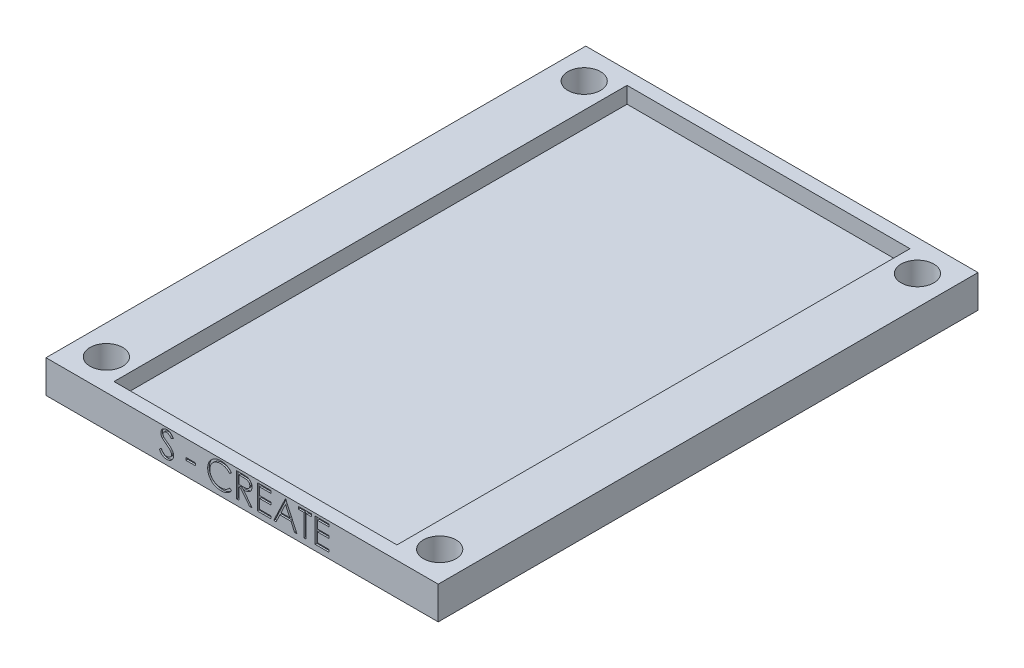
from build123d import *

# Parameters (mm, degrees)
SKETCH1_W           = 304.546
SKETCH1_H           = 419.1
BOSS_EXTRUDE1_DEPTH = 25.4
CUT_EXTRUDE1_REACH  = 262.276
SKETCH2_R           = 12.7
SKETCH3_W           = 219.698600032
SKETCH3_H           = 398.34825111
CUT_EXTRUDE2_DEPTH  = 12.7
WRAP1_START         = -1.27
WRAP1_OUTLINE_W     = 7.326923077
WRAP1_OUTLINE_H     = 1.953846154
WRAP1_DEPTH         = 1.27


# Read off the part's stored shape, not the designer's step: Wrap1
with BuildPart() as part:
    # Sketch1 → Boss-Extrude1 (new body)
    with BuildSketch(Plane(origin=(0, 0, 0), x_dir=(1, 0, 0), z_dir=(0, 1, 0))):
        Rectangle(SKETCH1_W, SKETCH1_H)
    extrude(amount=BOSS_EXTRUDE1_DEPTH)

    # Sketch2 → Cut-Extrude1 (cut, up to next)
    with BuildSketch(Plane(origin=(0, 25.4, 0), x_dir=(1, 0, 0), z_dir=(0, 1, 0)), mode=Mode.PRIVATE) as cut_extrude1_sk1:
        with Locations(Location((-129.389965873, 185.42, 0), (0, 0, 270))):
            Circle(SKETCH2_R)
    cut_extrude1_tool1 = extrude(cut_extrude1_sk1.sketch, amount=-CUT_EXTRUDE1_REACH, mode=Mode.PRIVATE) & part.part
    # Sketch2 → Cut-Extrude1 (cut, up to next)
    with BuildSketch(Plane(origin=(0, 25.4, 0), x_dir=(1, 0, 0), z_dir=(0, 1, 0)), mode=Mode.PRIVATE) as cut_extrude1_sk2:
        with Locations(Location((-129.389965873, -185.53228954, 0), (0, 0, 270))):
            Circle(SKETCH2_R)
    cut_extrude1_tool2 = extrude(cut_extrude1_sk2.sketch, amount=-CUT_EXTRUDE1_REACH, mode=Mode.PRIVATE) & part.part
    cut_extrude1_1 = cut_extrude1_tool1.solids().sort_by_distance((-129.389966, 25.4, -185.42))[0]
    add(cut_extrude1_1, mode=Mode.SUBTRACT)
    cut_extrude1_2 = cut_extrude1_tool2.solids().sort_by_distance((-129.389966, 25.4, 185.53229))[0]
    add(cut_extrude1_2, mode=Mode.SUBTRACT)
    cut_extrude1 = cut_extrude1_1 + cut_extrude1_2  # Cut-Extrude1 as one shape, for the pattern or mirror that repeats it

    # Mirror1: Cut-Extrude1 across plane
    add(cut_extrude1.mirror(Plane(origin=(0, 0, 0), x_dir=(0, 0, 1), z_dir=(1, 0, 0))), mode=Mode.SUBTRACT)

    # Sketch3 → Cut-Extrude2 (cut)
    with BuildSketch(Plane(origin=(0, 25.4, 0), x_dir=(1, 0, 0), z_dir=(0, 1, 0))):
        Rectangle(SKETCH3_W, SKETCH3_H)
    extrude(amount=-CUT_EXTRUDE2_DEPTH, mode=Mode.SUBTRACT)

    # Wrap1 outline → Wrap1 (cut)
    # profile 1 of 8: a face of its own
    with BuildSketch(Plane.XY.offset(209.55).offset(WRAP1_START)):
        with BuildLine():
            add(Edge.make_bspline(
                [(-62.746564703, 9.040953764), (-62.596786869, 8.790231897), (-62.309818318, 8.309858476), (-61.831111635, 7.660753999), (-61.335088218, 7.10905426), (-60.818074846, 6.657968725), (-60.283227328, 6.302828355), (-59.727054121, 6.051356209), (-59.151429466, 5.894514971), (-58.759686238, 5.8754645), (-58.56411278, 5.865953764)],
                knots=[0, 0, 0, 0, 0.159004299, 0.3046461, 0.438546905, 0.562322299, 0.677432543, 0.786897393, 0.893610889, 1, 1, 1, 1], degree=3))
            Line((-62.746564703, 9.040953764), (-64.356961337, 8.075479004))
            add(Edge.make_bspline(
                [(-58.56411278, 3.91210761), (-58.707996575, 3.914889898), (-58.993952098, 3.920419435), (-59.416913706, 3.969303261), (-59.831330613, 4.038466211), (-60.232002634, 4.148270792), (-60.624091974, 4.281495481), (-61.005893351, 4.44553412), (-61.377591801, 4.642114888), (-61.741270359, 4.866877808), (-62.096004081, 5.128449246), (-62.438465756, 5.433104991), (-62.779891752, 5.772442668), (-63.11020458, 6.155677306), (-63.436085551, 6.576617442), (-63.751109466, 7.039201426), (-64.061797101, 7.540909595), (-64.256735576, 7.89396099), (-64.356961337, 8.075479004)],
                knots=[0, 0, 0, 0, 0.057208269, 0.11369606, 0.169177916, 0.224159217, 0.278719878, 0.333794217, 0.389241459, 0.445822073, 0.503704281, 0.564293892, 0.627975416, 0.69503826, 0.765372726, 0.839611443, 0.91753775, 1, 1, 1, 1], degree=3))
            add(Edge.make_bspline(
                [(-53.122345953, 9.067666504), (-53.125922662, 8.896878546), (-53.133006622, 8.558619215), (-53.214436739, 8.061930868), (-53.333742345, 7.579525706), (-53.51355929, 7.117366651), (-53.733032479, 6.666998729), (-54.011523057, 6.240235728), (-54.334326313, 5.82763233), (-54.704624376, 5.440190755), (-55.109822787, 5.084520746), (-55.538086897, 4.768132568), (-55.990117668, 4.504326408), (-56.463462906, 4.289056825), (-56.958231338, 4.120690108), (-57.474256562, 3.998700063), (-58.012389187, 3.923829694), (-58.378151808, 3.916058592), (-58.56411278, 3.91210761)],
                knots=[0, 0, 0, 0, 0.061484255, 0.121774528, 0.18091956, 0.240256115, 0.300114444, 0.361145948, 0.423500582, 0.488669361, 0.553954105, 0.617581261, 0.680238427, 0.742187389, 0.804663212, 0.868258989, 0.933020257, 1, 1, 1, 1], degree=3))
            add(Edge.make_bspline(
                [(-57.610086337, 15.215412898), (-57.403334438, 15.064964927), (-57.002988039, 14.773643283), (-56.433351783, 14.335952224), (-55.916858342, 13.907883655), (-55.451694334, 13.492171251), (-55.033264304, 13.091968345), (-54.666210424, 12.702460177), (-54.34679265, 12.326437275), (-54.002917189, 11.844349398), (-53.6515382, 11.252269497), (-53.349777995, 10.526855084), (-53.159504704, 9.798620825), (-53.134622599, 9.309161901), (-53.122345953, 9.067666504)],
                knots=[0, 0, 0, 0, 0.09697231, 0.187773439, 0.272396139, 0.351320997, 0.424334774, 0.491908784, 0.55423322, 0.611267658, 0.716347845, 0.814540086, 0.908495456, 1, 1, 1, 1], degree=3))
            add(Edge.make_bspline(
                [(-60.170693308, 17.112017466), (-60.128993553, 17.074804511), (-60.029924479, 16.986395049), (-59.848808369, 16.841657064), (-59.609633996, 16.66311626), (-59.318646872, 16.442205295), (-58.97048166, 16.185947623), (-58.565100076, 15.897619819), (-58.107020876, 15.567861821), (-57.78196302, 15.337315778), (-57.610086337, 15.215412898)],
                knots=[0, 0, 0, 0, 0.052594282, 0.124951974, 0.218093899, 0.333502411, 0.468789179, 0.624937586, 0.801683048, 1, 1, 1, 1], degree=3))
            add(Edge.make_bspline(
                [(-61.426192107, 19.573405687), (-61.424052374, 19.471344068), (-61.419769411, 19.267053939), (-61.360035155, 18.965239771), (-61.283294522, 18.664188052), (-61.161686769, 18.36525228), (-60.993800188, 18.063204412), (-60.773336302, 17.75284324), (-60.495678132, 17.431433226), (-60.282987536, 17.222387377), (-60.170693308, 17.112017466)],
                knots=[0, 0, 0, 0, 0.107285214, 0.214745861, 0.32293856, 0.434116163, 0.553412311, 0.686072985, 0.834255992, 1, 1, 1, 1], degree=3))
            add(Edge.make_bspline(
                [(-58.632802683, 21.985184533), (-58.82959747, 21.978589423), (-59.209097676, 21.965871376), (-59.74788739, 21.826969741), (-60.232812896, 21.608265616), (-60.649477572, 21.301751235), (-60.996388833, 20.938598404), (-61.247334258, 20.520702064), (-61.39837444, 20.059243558), (-61.416805476, 19.737343972), (-61.426192107, 19.573405687)],
                knots=[0, 0, 0, 0, 0.143073084, 0.275902964, 0.402370856, 0.528413645, 0.650356379, 0.765895086, 0.880774131, 1, 1, 1, 1], degree=3))
            add(Edge.make_bspline(
                [(-54.912099558, 19.542876841), (-55.005422419, 19.663102427), (-55.18514043, 19.894628797), (-55.457988066, 20.218866958), (-55.715155707, 20.515048082), (-55.968522883, 20.772305422), (-56.20470822, 21.004727033), (-56.433945264, 21.203716567), (-56.65293509, 21.371223736), (-56.928979989, 21.549986541), (-57.275786427, 21.727186939), (-57.711130832, 21.877132635), (-58.166078986, 21.967239472), (-58.475938837, 21.979153275), (-58.632802683, 21.985184533)],
                knots=[0, 0, 0, 0, 0.098469431, 0.189629101, 0.274184089, 0.352183161, 0.423198873, 0.488550946, 0.548473346, 0.601440164, 0.701198082, 0.799591802, 0.898545098, 1, 1, 1, 1], degree=3))
            Line((-54.912099558, 19.542876841), (-53.366576722, 20.714421312))
            add(Edge.make_bspline(
                [(-58.441997395, 23.939030687), (-58.217511649, 23.931287942), (-57.771081149, 23.915890093), (-57.114404704, 23.782009244), (-56.482158519, 23.560481302), (-55.973560178, 23.309083035), (-55.575509005, 23.057996329), (-55.271945988, 22.829288429), (-54.964329577, 22.565989623), (-54.65017845, 22.267398584), (-54.334815718, 21.930775553), (-54.0135595, 21.558425946), (-53.685658551, 21.152625263), (-53.474715941, 20.862931909), (-53.366576722, 20.714421312)],
                knots=[0, 0, 0, 0, 0.107232799, 0.213251813, 0.318830447, 0.426793531, 0.483645951, 0.543603822, 0.60830765, 0.67712676, 0.750685636, 0.828713418, 0.912190348, 1, 1, 1, 1], degree=3))
            add(Edge.make_bspline(
                [(-63.135807491, 19.493267466), (-63.128703425, 19.694815239), (-63.114647137, 20.093602843), (-62.995772322, 20.676156363), (-62.808141286, 21.232342434), (-62.545279111, 21.756654679), (-62.206421233, 22.235440946), (-61.814285287, 22.674208639), (-61.347225626, 23.043063351), (-60.834766348, 23.365346126), (-60.273845237, 23.617600376), (-59.686066177, 23.807887997), (-59.070494971, 23.915706957), (-58.653555052, 23.93117972), (-58.441997395, 23.939030687)],
                knots=[0, 0, 0, 0, 0.083785371, 0.165779888, 0.246280008, 0.327460928, 0.408796954, 0.489715241, 0.571376032, 0.655523321, 0.741019483, 0.826546761, 0.911988852, 1, 1, 1, 1], degree=3))
            add(Edge.make_bspline(
                [(-62.071113982, 16.593027081), (-62.155328835, 16.705155582), (-62.320948646, 16.925671327), (-62.539566476, 17.270339481), (-62.725381062, 17.623163254), (-62.871044613, 17.985090746), (-62.993706032, 18.351040858), (-63.076208484, 18.725788353), (-63.127868801, 19.107651691), (-63.133159185, 19.36462803), (-63.135807491, 19.493267466)],
                knots=[0, 0, 0, 0, 0.133506769, 0.262558979, 0.388264447, 0.512667355, 0.63372227, 0.75539386, 0.877552945, 1, 1, 1, 1], degree=3))
            add(Edge.make_bspline(
                [(-58.949539462, 14.001891264), (-59.149967213, 14.144649719), (-59.53316981, 14.417593015), (-60.069065808, 14.822673761), (-60.548279242, 15.193026822), (-60.968680175, 15.53213866), (-61.330083695, 15.840055266), (-61.635337689, 16.113819763), (-61.876666122, 16.360836001), (-62.010862925, 16.521081019), (-62.071113982, 16.593027081)],
                knots=[0, 0, 0, 0, 0.181535301, 0.347081672, 0.495567816, 0.628357302, 0.74551967, 0.845830751, 0.930781807, 1, 1, 1, 1], degree=3))
            add(Edge.make_bspline(
                [(-55.51504427, 10.964271072), (-55.600337184, 11.073383069), (-55.779398989, 11.302450058), (-56.08723345, 11.643419125), (-56.44845473, 11.995127948), (-56.850701221, 12.37100653), (-57.308625605, 12.753572966), (-57.807885362, 13.161070307), (-58.361227223, 13.578001748), (-58.749300197, 13.857615284), (-58.949539462, 14.001891264)],
                knots=[0, 0, 0, 0, 0.090279215, 0.189529918, 0.299197872, 0.418925887, 0.548376285, 0.68813637, 0.839083502, 1, 1, 1, 1], degree=3))
            add(Edge.make_bspline(
                [(-54.831961337, 9.094379245), (-54.8399858, 9.252988727), (-54.85629836, 9.575418626), (-54.994173987, 10.051122451), (-55.211067745, 10.521889154), (-55.411161562, 10.8130889), (-55.51504427, 10.964271072)],
                knots=[0, 0, 0, 0, 0.234723374, 0.477158319, 0.728556284, 1, 1, 1, 1], degree=3))
            add(Edge.make_bspline(
                [(-58.56411278, 5.865953764), (-58.397088582, 5.870605624), (-58.065962717, 5.879827948), (-57.578488223, 5.968442028), (-57.105058699, 6.104579473), (-56.655431685, 6.299547686), (-56.235811269, 6.535432872), (-55.867837685, 6.820345638), (-55.54972384, 7.139330844), (-55.289505659, 7.495199293), (-55.089861467, 7.877925487), (-54.936416066, 8.270768879), (-54.851262165, 8.679900658), (-54.838434693, 8.955366177), (-54.831961337, 9.094379245)],
                knots=[0, 0, 0, 0, 0.091263605, 0.180930311, 0.27008822, 0.360156133, 0.448342532, 0.532665842, 0.613833704, 0.693981527, 0.772715977, 0.849335172, 0.923967327, 1, 1, 1, 1], degree=3))
        make_face()
    # profile 2 of 8: a face of its own
    with BuildSketch(Plane.XY.offset(209.55).offset(WRAP1_START)):
        with BuildLine():
            add(Edge.make_bspline(
                [(-0.463902443, 23.450569148), (-0.209497158, 23.449722316), (0.278989171, 23.448096304), (0.978795114, 23.439029795), (1.614668313, 23.413043659), (2.186276296, 23.390681226), (2.693608575, 23.349903659), (3.138220829, 23.31092928), (3.518065297, 23.259909784), (3.74800343, 23.21252741), (3.852113182, 23.191073956)],
                knots=[0, 0, 0, 0, 0.176257755, 0.338434414, 0.484822051, 0.617157578, 0.734698361, 0.837385184, 0.926372421, 1, 1, 1, 1], degree=3))
            Line((-0.463902443, 23.450569148), (-4.276192107, 23.450569148))
            Line((-4.276192107, 23.450569148), (-4.276192107, 4.400569148))
            Line((-4.276192107, 4.400569148), (-2.566576722, 4.400569148))
            Line((-2.566576722, 4.400569148), (-2.566576722, 13.192876841))
            Line((-2.566576722, 13.192876841), (-1.177514222, 13.192876841))
            Line((-1.177514222, 13.192876841), (5.821223759, 4.400569148))
            Line((5.821223759, 4.400569148), (7.935346355, 4.400569148))
            Line((7.935346355, 4.400569148), (0.936608374, 13.192876841))
            add(Edge.make_bspline(
                [(7.691115586, 18.356067947), (7.683120039, 18.102239734), (7.667518656, 17.606955149), (7.522057735, 16.888166637), (7.283788392, 16.217664796), (6.955457347, 15.596293867), (6.537339915, 15.036165926), (6.034829266, 14.544183591), (5.447645067, 14.132486352), (4.901022647, 13.846993229), (4.418163932, 13.664151827), (4.020654043, 13.535502502), (3.587038066, 13.436105234), (3.121470573, 13.347059374), (2.622014105, 13.279830866), (2.089865748, 13.230591544), (1.52464598, 13.199817365), (1.136357617, 13.195234453), (0.936608374, 13.192876841)],
                knots=[0, 0, 0, 0, 0.078780236, 0.153720644, 0.22671353, 0.299191166, 0.371189997, 0.443006414, 0.516689173, 0.593217217, 0.633872918, 0.676989142, 0.722899506, 0.771958611, 0.824211323, 0.879378651, 0.937948119, 1, 1, 1, 1], degree=3))
            add(Edge.make_bspline(
                [(3.852113182, 23.191073956), (3.991486379, 23.156638276), (4.267259565, 23.088501523), (4.664316353, 22.944485695), (5.042672887, 22.777827453), (5.400757502, 22.582082061), (5.736776595, 22.355796474), (6.054194829, 22.102877122), (6.354452565, 21.824707902), (6.625406867, 21.514275408), (6.88088942, 21.188593833), (7.096364658, 20.836420528), (7.282110212, 20.4681485), (7.429995455, 20.080032412), (7.549074139, 19.675836196), (7.633036956, 19.251898603), (7.683389849, 18.81015101), (7.688516234, 18.508845821), (7.691115586, 18.356067947)],
                knots=[0, 0, 0, 0, 0.064216843, 0.127063766, 0.188744538, 0.249132103, 0.309452533, 0.369826676, 0.430650142, 0.492351932, 0.554072106, 0.615689784, 0.676797703, 0.738439048, 0.80131691, 0.865184512, 0.931641324, 1, 1, 1, 1], degree=3))
        make_face()
        with BuildLine():
            add(Edge.make_bspline(
                [(0.921343951, 15.120010254), (1.084194449, 15.119938209), (1.399845095, 15.119798565), (1.856504428, 15.141536118), (2.281701036, 15.166264751), (2.673808558, 15.204089046), (3.033002161, 15.252835665), (3.35910231, 15.313811907), (3.652641321, 15.38485242), (3.994989081, 15.494806983), (4.377276487, 15.669011168), (4.792737719, 15.922460525), (5.146536157, 16.241243874), (5.445446236, 16.605770828), (5.685636427, 17.006562411), (5.854974895, 17.438814363), (5.962430188, 17.891614346), (5.975104128, 18.202826619), (5.981500201, 18.359884052)],
                knots=[0, 0, 0, 0, 0.07166815, 0.138913286, 0.20118457, 0.259124428, 0.312255041, 0.36068151, 0.405086143, 0.445101659, 0.51877778, 0.589461579, 0.658462242, 0.727283218, 0.796322487, 0.863174893, 0.930949381, 1, 1, 1, 1], degree=3))
            Line((0.921343951, 15.120010254), (-2.566576722, 15.146722995))
            Line((-2.566576722, 15.146722995), (-2.566576722, 21.496722995))
            Line((-2.566576722, 21.496722995), (1.005298278, 21.496722995))
            add(Edge.make_bspline(
                [(5.981500201, 18.359884052), (5.974957228, 18.513081832), (5.961991442, 18.816663931), (5.856134573, 19.261105386), (5.677122369, 19.680569786), (5.43588276, 20.073350768), (5.141973074, 20.429889131), (4.797343264, 20.734945778), (4.411416417, 20.986675007), (4.050711751, 21.147535278), (3.728308395, 21.246159051), (3.448384102, 21.315561814), (3.132091631, 21.371320995), (2.777895206, 21.415996298), (2.387306901, 21.454395351), (1.958351786, 21.480258604), (1.493875882, 21.495574064), (1.171947585, 21.496331105), (1.005298278, 21.496722995)],
                knots=[0, 0, 0, 0, 0.068814296, 0.136364825, 0.204019354, 0.273063739, 0.34291332, 0.410965444, 0.479168767, 0.549308007, 0.587651576, 0.630646669, 0.678878786, 0.731934299, 0.791111423, 0.85528319, 0.925085939, 1, 1, 1, 1], degree=3))
        make_face(mode=Mode.SUBTRACT)
    # profile 3 of 8: a face of its own
    with BuildSketch(Plane.XY.offset(209.55).offset(WRAP1_START)):
        with BuildLine():
            add(Edge.make_bspline(
                [(-9.679797876, 18.810184533), (-9.786509925, 18.937362169), (-9.998495314, 19.19000281), (-10.339540402, 19.544765759), (-10.694967916, 19.877135254), (-11.06464199, 20.188694627), (-11.455216626, 20.468548738), (-11.857230402, 20.731281455), (-12.277408333, 20.966781572), (-12.858442775, 21.25233011), (-13.618526063, 21.550305611), (-14.575352259, 21.800150342), (-15.574176952, 21.959197026), (-16.255609601, 21.976422806), (-16.602213741, 21.985184533)],
                knots=[0, 0, 0, 0, 0.063163259, 0.125474941, 0.18712122, 0.248294346, 0.309294856, 0.369850066, 0.430973376, 0.49245599, 0.616147966, 0.740843698, 0.868182649, 1, 1, 1, 1], degree=3))
            Line((-9.679797876, 18.810184533), (-8.183884414, 19.955016264))
            add(Edge.make_bspline(
                [(-16.49536278, 23.939030687), (-16.276481154, 23.936406478), (-15.843227018, 23.93121212), (-15.202316153, 23.880560118), (-14.578334345, 23.796121775), (-13.970851714, 23.681190024), (-13.376912903, 23.538547317), (-12.801057306, 23.35272655), (-12.239905882, 23.140256287), (-11.696997711, 22.895553779), (-11.174937631, 22.620870516), (-10.67388824, 22.319251193), (-10.197829509, 21.991069737), (-9.743411634, 21.639117311), (-9.318236256, 21.25594801), (-8.910231637, 20.852101095), (-8.533253483, 20.415944138), (-8.300553951, 20.10894014), (-8.183884414, 19.955016264)],
                knots=[0, 0, 0, 0, 0.068547537, 0.135682946, 0.20121499, 0.265682235, 0.329266835, 0.392395428, 0.455069762, 0.51712685, 0.578790035, 0.639739863, 0.700191504, 0.759806243, 0.819628319, 0.879354791, 0.939511608, 1, 1, 1, 1], degree=3))
            add(Edge.make_bspline(
                [(-26.745422876, 14.036236216), (-26.736958179, 14.378893756), (-26.720304418, 15.053051074), (-26.578813017, 16.042420734), (-26.351199283, 16.990301919), (-26.027910504, 17.894925157), (-25.618034235, 18.76104854), (-25.111703665, 19.582055669), (-24.514801077, 20.363197107), (-23.832007887, 21.092620254), (-23.083248533, 21.759584444), (-22.281413275, 22.34635821), (-21.428071535, 22.834677833), (-20.532624371, 23.242871231), (-19.58836659, 23.556621809), (-18.597312823, 23.77625844), (-17.561325301, 23.912967316), (-16.85450267, 23.930249519), (-16.49536278, 23.939030687)],
                knots=[0, 0, 0, 0, 0.064557846, 0.127013532, 0.18795481, 0.248013913, 0.307747682, 0.368234515, 0.429469844, 0.492743437, 0.556257769, 0.618216786, 0.679655476, 0.741245546, 0.803415265, 0.866815462, 0.932328312, 1, 1, 1, 1], degree=3))
            add(Edge.make_bspline(
                [(-24.329827924, 7.243567947), (-24.522699069, 7.480556418), (-24.90611285, 7.951672227), (-25.396654071, 8.715228782), (-25.816557193, 9.512434319), (-26.156060419, 10.347477074), (-26.421469009, 11.218483282), (-26.605335228, 12.125892011), (-26.724814675, 13.06885581), (-26.738477818, 13.710224617), (-26.745422876, 14.036236216)],
                knots=[0, 0, 0, 0, 0.12432851, 0.247156016, 0.368779749, 0.490733862, 0.613613772, 0.738957576, 0.867310575, 1, 1, 1, 1], degree=3))
            add(Edge.make_bspline(
                [(-16.472466145, 3.91210761), (-16.677355247, 3.913533598), (-17.082498075, 3.916353313), (-17.68066128, 3.962030681), (-18.262990284, 4.024349964), (-18.827820748, 4.118185534), (-19.378234983, 4.228916871), (-19.909243307, 4.377350425), (-20.426070952, 4.543625174), (-20.926641492, 4.739050888), (-21.411380716, 4.959574681), (-21.878725175, 5.208811595), (-22.328459928, 5.484665744), (-22.765006576, 5.781056586), (-23.181916281, 6.107504472), (-23.582801898, 6.459475726), (-23.969911376, 6.835784041), (-24.209411704, 7.107136886), (-24.329827924, 7.243567947)],
                knots=[0, 0, 0, 0, 0.069662801, 0.137749562, 0.203916744, 0.268779862, 0.332413706, 0.39475354, 0.456180032, 0.516995649, 0.577395938, 0.637198344, 0.696999184, 0.756756194, 0.816553905, 0.876947997, 0.938131788, 1, 1, 1, 1], degree=3))
            add(Edge.make_bspline(
                [(-8.183884414, 7.90757035), (-8.304270127, 7.752239634), (-8.544464911, 7.442322225), (-8.933400689, 7.005414776), (-9.343124265, 6.594457097), (-9.776678915, 6.212762473), (-10.22907718, 5.852693168), (-10.708442195, 5.524478915), (-11.208472214, 5.22353853), (-11.727473021, 4.947983413), (-12.264893185, 4.703505254), (-12.820088752, 4.494206889), (-13.390666599, 4.313912847), (-13.976652809, 4.165584449), (-14.579262857, 4.049808978), (-15.196322152, 3.972413319), (-15.829162473, 3.919389471), (-16.256107922, 3.914556672), (-16.472466145, 3.91210761)],
                knots=[0, 0, 0, 0, 0.061674239, 0.123053062, 0.183475001, 0.243726501, 0.304278917, 0.364862921, 0.425946204, 0.48739123, 0.549220384, 0.611143589, 0.67352853, 0.736961457, 0.800785283, 0.866012596, 0.932100748, 1, 1, 1, 1], degree=3))
            Line((-8.183884414, 7.90757035), (-9.679797876, 9.040953764))
            add(Edge.make_bspline(
                [(-16.483914462, 5.865953764), (-16.151341255, 5.875145551), (-15.496757625, 5.893237186), (-14.536811653, 6.046503957), (-13.6178627, 6.295013481), (-12.739861336, 6.642800744), (-11.905282762, 7.094913239), (-11.112820939, 7.642997401), (-10.361806963, 8.292266755), (-9.910206127, 8.78801921), (-9.679797876, 9.040953764)],
                knots=[0, 0, 0, 0, 0.12851519, 0.252948636, 0.374754734, 0.495939754, 0.617180641, 0.740909469, 0.867811148, 1, 1, 1, 1], degree=3))
            add(Edge.make_bspline(
                [(-25.035807491, 13.90648862), (-25.02893959, 13.624922435), (-25.015455378, 13.072104581), (-24.895449446, 12.262367401), (-24.71308602, 11.486647733), (-24.439769809, 10.749794592), (-24.102753262, 10.042721957), (-23.676900791, 9.377393341), (-23.183687923, 8.743754611), (-22.616137155, 8.156780852), (-21.993442642, 7.620584719), (-21.325343294, 7.148413697), (-20.613503099, 6.754814122), (-19.865781727, 6.427285042), (-19.076425307, 6.175516281), (-18.246853311, 5.998274409), (-17.378870022, 5.882656255), (-16.785765146, 5.871587181), (-16.483914462, 5.865953764)],
                knots=[0, 0, 0, 0, 0.064323217, 0.126290104, 0.186726469, 0.246146432, 0.305575643, 0.365429386, 0.426326309, 0.488839906, 0.551724972, 0.613918596, 0.675483766, 0.737333897, 0.800229044, 0.864502298, 0.931040739, 1, 1, 1, 1], degree=3))
            add(Edge.make_bspline(
                [(-16.602213741, 21.985184533), (-16.793167128, 21.982985823), (-17.173301673, 21.978608809), (-17.737445507, 21.920864856), (-18.291055114, 21.83970527), (-18.83377038, 21.719280296), (-19.364900483, 21.567029326), (-19.8879177, 21.385099573), (-20.395249679, 21.160011088), (-20.893914661, 20.911227559), (-21.371684367, 20.630226752), (-21.823741127, 20.323721223), (-22.248436209, 19.995140855), (-22.64610557, 19.643254119), (-23.017155746, 19.269645734), (-23.358898109, 18.870334103), (-23.670150127, 18.446595845), (-23.957081364, 18.004018584), (-24.214053527, 17.543891461), (-24.429209013, 17.064511434), (-24.619736893, 16.574087673), (-24.770499913, 16.067079212), (-24.889831926, 15.547053587), (-24.972169637, 15.012615155), (-25.029256887, 14.464880414), (-25.033612135, 14.093626869), (-25.035807491, 13.90648862)],
                knots=[0, 0, 0, 0, 0.043954909, 0.087501875, 0.130462627, 0.172752021, 0.215403067, 0.25764983, 0.300152749, 0.34312149, 0.385925163, 0.427685727, 0.46881795, 0.5094918, 0.549883031, 0.589980023, 0.63040523, 0.670868626, 0.711383944, 0.751627258, 0.791775577, 0.832458919, 0.873319045, 0.914542956, 0.956923558, 1, 1, 1, 1], degree=3))
        make_face()
    # profile 4 of 8: a face of its own
    with BuildSketch(Plane.XY.offset(209.55).offset(WRAP1_START)):
        Polygon((67.527654047, 21.496722995), (67.527654047, 23.450569148), (56.781500201, 23.450569148), (56.781500201, 4.400569148), (67.527654047, 4.400569148), (67.527654047, 6.354415302), (58.491115586, 6.354415302), (58.491115586, 13.681338379), (67.527654047, 13.681338379), (67.527654047, 15.635184533), (58.491115586, 15.635184533), (58.491115586, 21.496722995), align=None)
    # profile 5 of 8: a face of its own
    with BuildSketch(Plane.XY.offset(209.55).offset(WRAP1_START)):
        Polygon((49.698807893, 21.496722995), (53.85073097, 21.496722995), (53.85073097, 23.450569148), (43.837269432, 23.450569148), (43.837269432, 21.496722995), (47.989192509, 21.496722995), (47.989192509, 4.400569148), (49.698807893, 4.400569148), align=None)
    # profile 6 of 8: a face of its own
    with BuildSketch(Plane.XY.offset(209.55).offset(WRAP1_START)):
        Polygon((13.552654047, 21.496722995), (22.589192509, 21.496722995), (22.589192509, 23.450569148), (11.843038663, 23.450569148), (11.843038663, 4.400569148), (22.589192509, 4.400569148), (22.589192509, 6.354415302), (13.552654047, 6.354415302), (13.552654047, 13.681338379), (22.589192509, 13.681338379), (22.589192509, 15.635184533), (13.552654047, 15.635184533), align=None)
    # profile 7 of 8: a face of its own
    with BuildSketch(Plane.XY.offset(209.55).offset(WRAP1_START)):
        Polygon((40.757672076, 4.400569148), (42.616115586, 4.400569148), (33.823807893, 23.450569148), (33.579577124, 23.450569148), (24.543038663, 4.400569148), (26.409114384, 4.400569148), (29.305538663, 10.506338379), (37.941386018, 10.506338379), align=None)
        Polygon((37.040785057, 12.460184533), (30.232852365, 12.460184533), (33.68261198, 19.737498235), align=None, mode=Mode.SUBTRACT)
    # profile 8 of 8: a face of its own
    with BuildSketch(Plane.XY.offset(209.55).offset(WRAP1_START)):
        with Locations((-39.933884414, 11.727492225)):
            Rectangle(WRAP1_OUTLINE_W, WRAP1_OUTLINE_H)
    extrude(amount=WRAP1_DEPTH, mode=Mode.SUBTRACT)


solid = part.part
